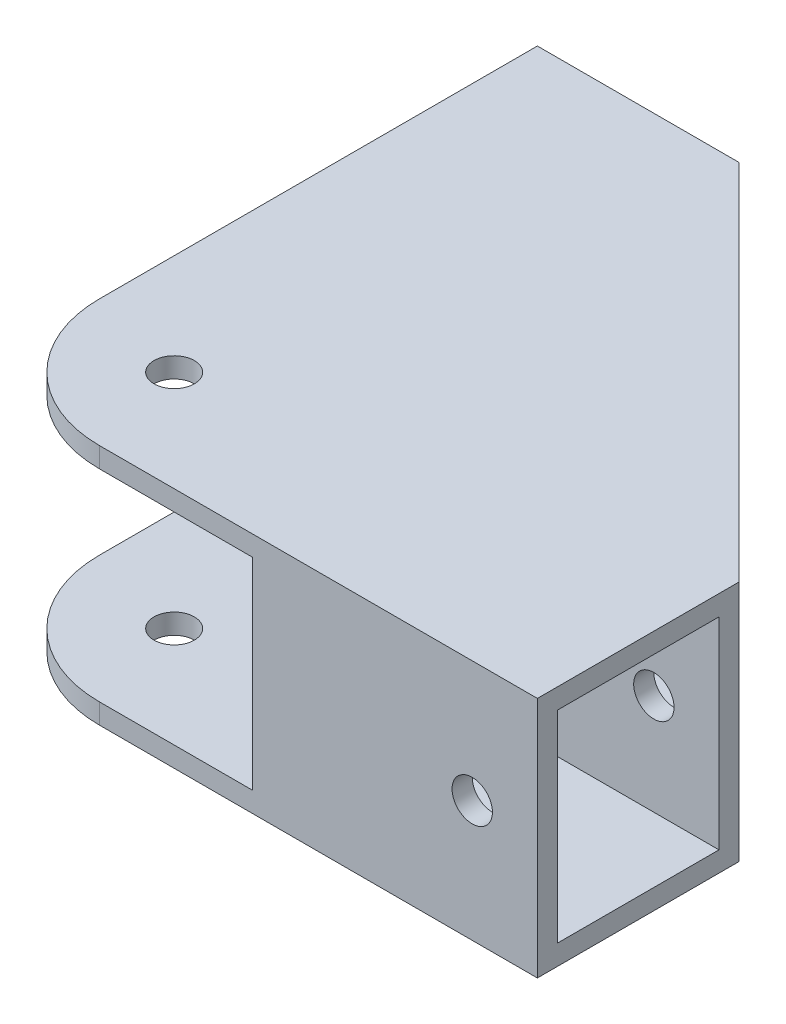
from build123d import *

# Parameters (mm, degrees)
BOSS_EXTRUDE1_DEPTH     = 38.1
SKETCH2_W               = 25.4
SKETCH2_H               = 31.75
CUT_EXTRUDE1_DEPTH      = 88.9
CUT_EXTRUDE2_REACH      = 133.37
SKETCH3_W               = 25.4
SKETCH3_H               = 31.75
CUT_EXTRUDE3_START      = -62.861793
SKETCH4_W               = 75
SKETCH4_H               = 31.75
CUT_EXTRUDE3_DEPTH      = 28.575
FILLET4_R               = 20
CUT_EXTRUDE8_DEPTH      = 131.484388453
CUT_EXTRUDE8_DEPTH_BACK = 131.484388453
SKETCH8_R               = 3.175
BOSS_EXTRUDE2_DEPTH     = 3.175
CUT_EXTRUDE10_REACH     = 133.37
SKETCH35_R              = 3.175
CUT_EXTRUDE11_REACH     = 133.37
SKETCH36_R              = 3.175
FILLET8_R               = 5
CHAMFER1_SIZE           = 10
CHAMFER1_SIZE_2         = 7.071067812


with BuildPart() as part:
    # Sketch1 → Boss-Extrude1 (new body)
    with BuildSketch(Plane(origin=(0, 0, 0), x_dir=(1, 0, 0), z_dir=(0, 1, 0))):
        Polygon((0, 0), (-88.9, 0), (-88.9, 88.9), (-57.15, 88.9), (-57.15, 31.75), (0, 31.75), align=None)
    extrude(amount=BOSS_EXTRUDE1_DEPTH)

    # Sketch2 → Cut-Extrude1 (cut)
    with BuildSketch(Plane(origin=(0, 0, 0), x_dir=(0, 0, -1), z_dir=(1, 0, 0))):
        with Locations((15.875, 19.05)):
            Rectangle(SKETCH2_W, SKETCH2_H)
    extrude(amount=-CUT_EXTRUDE1_DEPTH, mode=Mode.SUBTRACT)

    # Cut-Extrude2: up to this face of the body (flat: up to its plane)
    cut_extrude2_end = Plane(part.part.faces().sort_by_distance((-44.45, 19.05, 0))[0])
    # Sketch3 → Cut-Extrude2 (cut, up to the picked face)
    with BuildSketch(Plane(origin=(0, 0, -88.9), x_dir=(-1, 0, 0), z_dir=(0, 0, -1)), mode=Mode.PRIVATE) as cut_extrude2_sk1:
        with Locations((73.025, 19.05)):
            Rectangle(SKETCH3_W, SKETCH3_H)
    cut_extrude2_tool1 = split(extrude(cut_extrude2_sk1.sketch, amount=-CUT_EXTRUDE2_REACH, mode=Mode.PRIVATE), bisect_by=cut_extrude2_end, keep=Keep.BOTH, mode=Mode.PRIVATE)
    add(cut_extrude2_tool1.solids().sort_by(Axis((-73.025, 19.05, -88.9), (0, 0, 1)))[0], mode=Mode.SUBTRACT)

    # Sketch4 → Cut-Extrude3 (cut)
    with BuildSketch(Plane(origin=(0, 0, 0), x_dir=(-0.7071067811865475, 0, -0.7071067811865476), z_dir=(0.7071067811865476, 0, -0.7071067811865475)).offset(CUT_EXTRUDE3_START)):
        with Locations((62.861792847, 19.05)):
            Rectangle(SKETCH4_W, SKETCH4_H)
    extrude(amount=CUT_EXTRUDE3_DEPTH, mode=Mode.SUBTRACT)

    # Fillet4
    fillet4_edges = [part.edges().sort_by_distance(p)[0] for p in [
        (-88.9, 36.5125, 0),
        (-88.9, 1.5875, 0),
    ]]
    fillet(fillet4_edges, radius=FILLET4_R)

    # Sketch8 → Cut-Extrude8 (cut, two sides: drawn at the far end of the back side and taken through both)
    with BuildSketch(Plane.XZ.offset(-34.925).offset(-CUT_EXTRUDE8_DEPTH_BACK)):
        with Locations(Location((-73.025, -15.875, 0), (0, 0, 270))):
            Circle(SKETCH8_R)
    extrude(amount=CUT_EXTRUDE8_DEPTH + CUT_EXTRUDE8_DEPTH_BACK, mode=Mode.SUBTRACT)

    # Sketch29 → Boss-Extrude2 (add)
    with BuildSketch(Plane(origin=(0, 38.1, 0), x_dir=(1, 0, 0), z_dir=(0, 1, 0))):
        Polygon((-57.15, 88.9), (0, 31.75), (-57.15, 31.75), align=None)
    boss_extrude2 = extrude(amount=-BOSS_EXTRUDE2_DEPTH)

    # Cut-Extrude10: up to this face of the body (flat: up to its plane)
    cut_extrude10_end = Plane(part.part.faces().sort_by_distance((-57.15, 17.4625, -60.325))[0])
    # Sketch35 → Cut-Extrude10 (cut, up to the picked face)
    with BuildSketch(Plane.ZY.offset(88.9), mode=Mode.PRIVATE) as cut_extrude10_sk1:
        with Locations((-78.65, 19.05)):
            Circle(SKETCH35_R)
    cut_extrude10_tool1 = split(extrude(cut_extrude10_sk1.sketch, amount=-CUT_EXTRUDE10_REACH, mode=Mode.PRIVATE), bisect_by=cut_extrude10_end, keep=Keep.BOTH, mode=Mode.PRIVATE)
    add(cut_extrude10_tool1.solids().sort_by(Axis((-88.9, 19.05, -78.65), (1, 0, 0)))[0], mode=Mode.SUBTRACT)

    # Cut-Extrude11: up to this face of the body (flat: up to its plane)
    cut_extrude11_end = Plane(part.part.faces().sort_by_distance((-28.575, 17.4625, -31.75))[0])
    # Sketch36 → Cut-Extrude11 (cut, up to the picked face)
    with BuildSketch(Plane.XY, mode=Mode.PRIVATE) as cut_extrude11_sk1:
        with Locations((-10.25, 19.05)):
            Circle(SKETCH36_R)
    cut_extrude11_tool1 = split(extrude(cut_extrude11_sk1.sketch, amount=-CUT_EXTRUDE11_REACH, mode=Mode.PRIVATE), bisect_by=cut_extrude11_end, keep=Keep.BOTH, mode=Mode.PRIVATE)
    add(cut_extrude11_tool1.solids().sort_by(Axis((-10.25, 19.05, 0), (0, 0, -1)))[0], mode=Mode.SUBTRACT)

    # Mirror1: Boss-Extrude2 across plane
    add(boss_extrude2.mirror(Plane(origin=(0, 19.05, 0), x_dir=(0, 0, 1), z_dir=(0, -1, 0))))

    # Fillet8
    fillet8_edges = [part.edges().sort_by_distance(p)[0] for p in [
        (-60.325, 19.05, -28.575),
    ]]
    fillet(fillet8_edges, radius=FILLET8_R)

    # Chamfer1
    # the kernel refuses this chamfer: 10, 7.071067812 mm, written as the material it takes off along each edge
    with BuildSketch(Plane(origin=(-51.663847671, 3.175, -3.175), x_dir=(0.9996219169112968, 0, -0.027495876610586317), z_dir=(0, 1, 0)), Plane(origin=(-85.725, 34.925, -37.236152329), x_dir=(0.027495876610586317, 0, -0.9996219169112968), z_dir=(0, -1, 0))) as chamfer1_piece_1:
        Polygon((CHAMFER1_SIZE * 0.999621916911, -CHAMFER1_SIZE * 0.0274958766106), (CHAMFER1_SIZE_2 * 0.687396915252, -CHAMFER1_SIZE_2 * 0.726281956863), (0, 0), align=None)
    extrude(amount=31.75, mode=Mode.SUBTRACT)


solid = part.part
